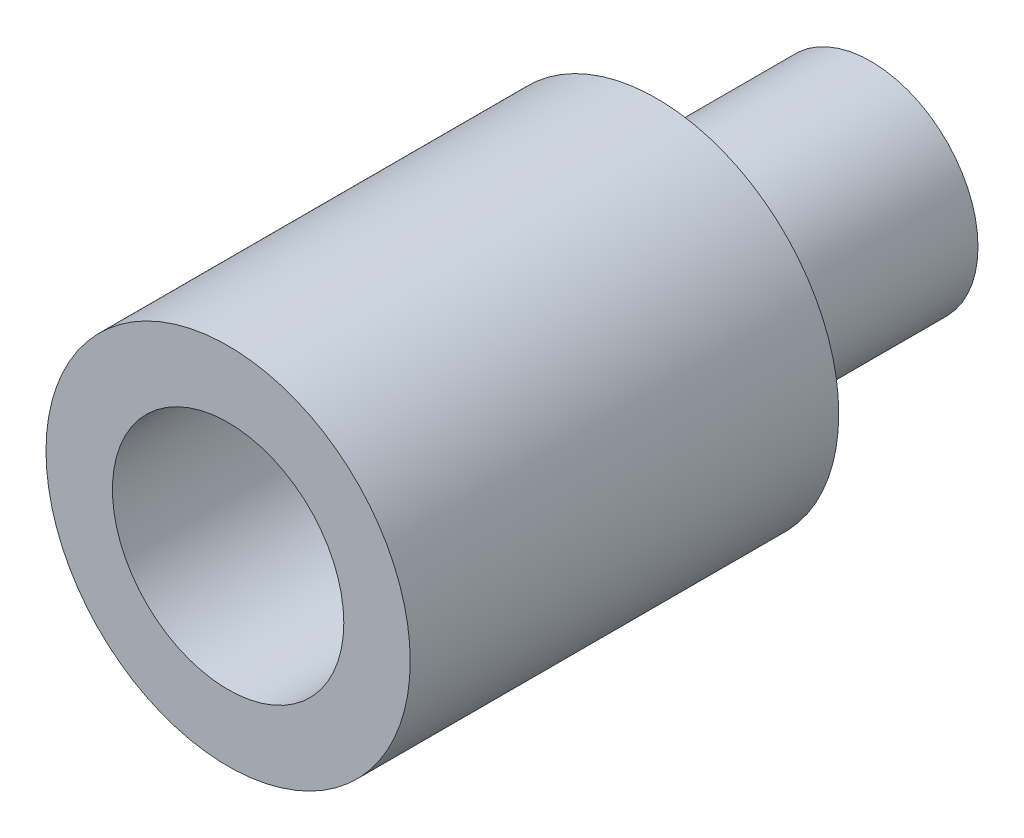
from build123d import *

# Parameters (mm, degrees)
SKETCH1_R           = 2.5
BOSS_EXTRUDE1_DEPTH = 5
SKETCH2_R           = 4.25
BOSS_EXTRUDE2_DEPTH = 10
SKETCH3_R           = 2.7
CUT_EXTRUDE1_DEPTH  = 8


with BuildPart() as part:
    # Sketch1 → Boss-Extrude1 (new body)
    with BuildSketch(Plane.XY):
        Circle(SKETCH1_R)
    extrude(amount=BOSS_EXTRUDE1_DEPTH)

    # Sketch2 → Boss-Extrude2 (add)
    with BuildSketch(Plane.XY.offset(5)):
        Circle(SKETCH2_R)
    extrude(amount=BOSS_EXTRUDE2_DEPTH)

    # Sketch3 → Cut-Extrude1 (cut)
    with BuildSketch(Plane.XY.offset(15)):
        Circle(SKETCH3_R)
    extrude(amount=-CUT_EXTRUDE1_DEPTH, mode=Mode.SUBTRACT)


solid = part.part
